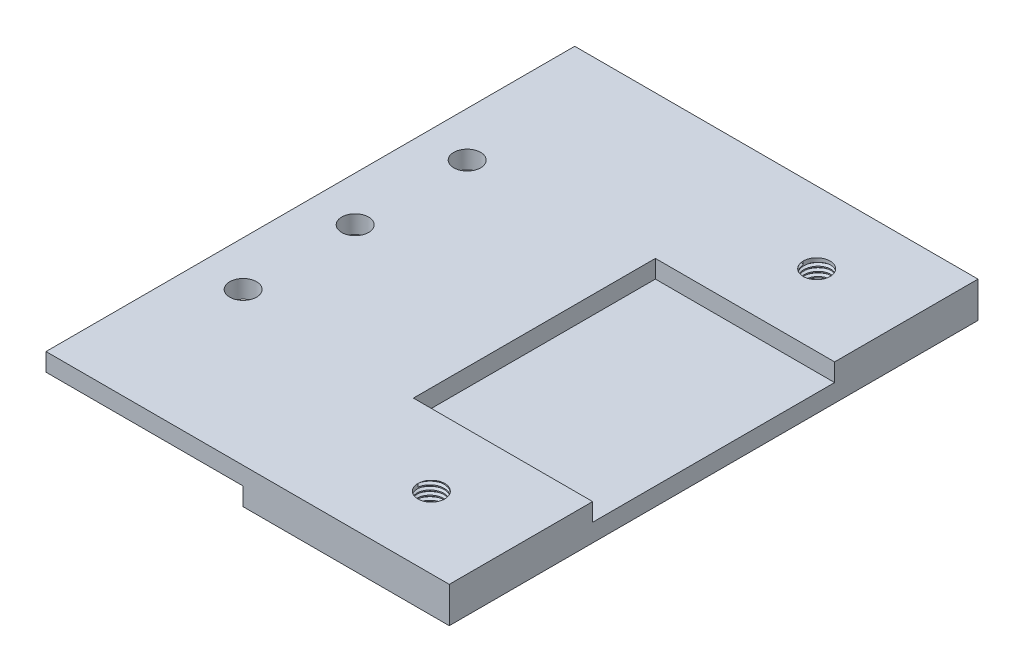
from build123d import *

# Parameters (mm, degrees)
EXTRUDE_497_DEPTH      = 29.5
EXTRUDE_497_DEPTH_BACK = 29.5
SKETCH_2_R             = 1.5
CUT_EXTRUDE_M3_3_DEPTH = 38.619808612
SKETCH_3_W             = 20
SKETCH_3_H             = 16
EXTRUDE_1270_DEPTH     = 2
SKETCH_4_R             = 1.5
CUT_EXTRUDE_M3_2_DEPTH = 38.619808612
THREAD_M3_2_PITCH      = 0.5


with BuildPart() as part:
    # Sketch 1 → Extrude 497 (new, two sides: drawn at the far end of the back side and taken through both)
    with BuildSketch(Plane.XY.offset(-EXTRUDE_497_DEPTH_BACK)):
        Polygon((0, 0), (23, 0), (23, 2), (3, 2), (3, 4), (-22, 4), (-22, 2), (0, 2), align=None)
    extrude(amount=EXTRUDE_497_DEPTH + EXTRUDE_497_DEPTH_BACK)

    # 草图2 → M3*3 定位孔 (cut, through all)
    with BuildSketch(Plane(origin=(0, 4, 0), x_dir=(1, 0, 0), z_dir=(0, 1, 0))):
        with Locations(Location((-17, -12.5, 0), (0, 0, 180))):
            Circle(SKETCH_2_R)
        with Locations(Location((-17, 0, 0), (0, 0, 180))):
            Circle(SKETCH_2_R)
        with Locations(Location((-17, 12.5, 0), (0, 0, 180))):
            Circle(SKETCH_2_R)
    extrude(amount=-CUT_EXTRUDE_M3_3_DEPTH, mode=Mode.SUBTRACT)

    # 草图3 → Extrude 1270 (add)
    with BuildSketch(Plane(origin=(0, 2, 0), x_dir=(1, 0, 0), z_dir=(0, 1, 0))):
        with Locations((13, -21.5)):
            Rectangle(SKETCH_3_W, SKETCH_3_H)
        with Locations((13, 21.5)):
            Rectangle(SKETCH_3_W, SKETCH_3_H)
    extrude(amount=EXTRUDE_1270_DEPTH)

    # 草图4 → M3*2 固定孔 (cut, through all)
    with BuildSketch(Plane(origin=(0, 4, 0), x_dir=(1, 0, 0), z_dir=(0, 1, 0))):
        with Locations(Location((13, -21.5, 0), (0, 0, 180))):
            Circle(SKETCH_4_R)
    cut_extrude_m3_2 = extrude(amount=-CUT_EXTRUDE_M3_2_DEPTH, mode=Mode.SUBTRACT)

    # M3*2 固定孔螺纹线: the profile of Sketch 1 2 profile screwed along a right-hand helix of 10 turns, 6 arcs to a turn; built about Z, then put on its axis
    thread_m3_2_z = Axis((0, 0, 0), (0, 0, 1))
    thread_m3_2_corners = [(1.4997, 0, -0.000173205), (1.770632938, 0, 0.156249999), (1.770632938, 0, 0.218749999), (1.4997, 0, 0.375173204)]
    with BuildLine(mode=Mode.PRIVATE) as thread_m3_2_profile:
        Line(thread_m3_2_corners[0], thread_m3_2_corners[1])
        Line(thread_m3_2_corners[1], thread_m3_2_corners[2])
        Line(thread_m3_2_corners[2], thread_m3_2_corners[3])
        Line(thread_m3_2_corners[3], thread_m3_2_corners[0])
    thread_m3_2_cap = Face(thread_m3_2_profile.wire())
    thread_m3_2_turn_angles = [0, 30, 60, 90, 120, 150, 180, 210, 240, 270, 300, 330, 360]
    thread_m3_2_turn_weights = [1, 0.8660254037844387, 1, 0.8660254037844387, 1, 0.8660254037844387, 1, 0.8660254037844387, 1, 0.8660254037844387, 1, 0.8660254037844387, 1]
    thread_m3_2_turn_rails = [Edge.make_bspline([Vector(p[0], p[1], 0).rotate(thread_m3_2_z, thread_m3_2_turn_angles[k]) / thread_m3_2_turn_weights[k] + Vector(0, 0, p[2] + THREAD_M3_2_PITCH * thread_m3_2_turn_angles[k] / 360) for k in range(13)], [0, 0, 0, 1, 1, 2, 2, 3, 3, 4, 4, 5, 5, 6, 6, 6], 2, thread_m3_2_turn_weights) for p in thread_m3_2_corners]
    thread_m3_2_turn_sides = [Face.make_surface_from_curves(thread_m3_2_turn_rails[p[0]], thread_m3_2_turn_rails[p[1]]) for p in [(0, 1), (1, 2), (2, 3), (3, 0)]]
    thread_m3_2 = Plane(origin=(13, 4, 21.5), x_dir=(-1, 0, 0), z_dir=(0, -1, 0)) * Solid(Shell([*[p.moved(Location((0, 0, THREAD_M3_2_PITCH * i))) for i in range(10) for p in thread_m3_2_turn_sides], thread_m3_2_cap, thread_m3_2_cap.rotate(thread_m3_2_z, 3600).moved(Location((0, 0, THREAD_M3_2_PITCH * 3600 / 360)))]))
    add(thread_m3_2, mode=Mode.SUBTRACT)

    # M3*2 固定孔镜像: M3*2 固定孔, M3*2 固定孔螺纹线 across plane
    add(cut_extrude_m3_2.mirror(Plane.XY), mode=Mode.SUBTRACT)
    add(thread_m3_2.mirror(Plane.XY), mode=Mode.SUBTRACT)


solid = part.part
